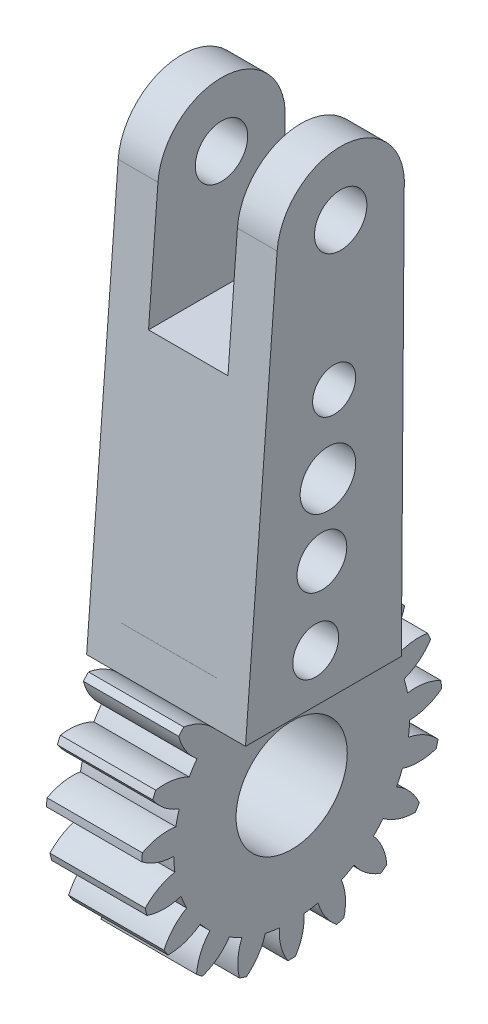
from build123d import *

# Parameters (mm, degrees)
SPUR_START             = -32.726855157
SPUR_GEAR_GB_OUTLINE_R = 22.5
SPUR_GEAR_GB_DEPTH     = 75
SKETCH_2_R             = 56.152658256
CUT_EXTRUDE_1_DEPTH    = 45
EXTRUDE_1_DEPTH        = 30
EXTRUDE_START          = -30
SKETCH_5_R             = 22.5
EXTRUDE_2_DEPTH        = 30
SCALE_1_SCALE          = 0.2
CUT_EXTRUDE_3_DEPTH    = 10
EXTRUDE_3_DEPTH        = 5
SKETCH_8_R             = 1.65
CUT_EXTRUDE_4_DEPTH    = 10
SKETCH_9_W             = 18.454746183
SKETCH_9_H             = 13.449677925
CUT_EXTRUDE_5_DEPTH    = 2.5
SKETCH_10_R            = 1.446114005
SKETCH_10_R_2          = 1.567494057
SKETCH_10_R_3          = 1.749983797
SKETCH_10_R_4          = 1.35600832
CUT_EXTRUDE_6_DEPTH    = 80.014451116


# Read off the part's stored shape, not the designer's step: spur gear_gb
with BuildPart() as part:
    # spur gear_gb outline → spur gear_gb (new body)
    with BuildSketch(Plane.YZ.offset(SPUR_START)):
        with BuildLine():
            ThreePointArc((32.862431273, 33.858374177), (32.001554259, 34.671025411), (31.120587981, 35.461853886))
            ThreePointArc((31.120587981, 35.461853886), (26.170323532, 33.302671085), (22.140322459, 29.707357493))
            ThreePointArc((22.140322459, 29.707357493), (20.304903422, 30.987038971), (18.395725829, 32.153824573))
            ThreePointArc((18.395725829, 32.153824573), (20.069385125, 37.288613083), (20.058208562, 42.689267077))
            ThreePointArc((20.058208562, 42.689267077), (18.980108815, 43.178360316), (17.890094133, 43.64029024))
            ThreePointArc((17.890094133, 43.64029024), (13.909134176, 39.99074968), (11.264886092, 35.281700885))
            ThreePointArc((11.264886092, 35.281700885), (9.113403224, 35.896086104), (6.928815473, 36.379743093))
            ThreePointArc((6.928815473, 36.379743093), (6.844528189, 41.779750883), (5.080367717, 46.884153523))
            ThreePointArc((5.080367717, 46.884153523), (3.901874073, 46.996687926), (2.720930993, 47.079662024))
            ThreePointArc((2.720930993, 47.079662024), (0.14067431, 42.335248053), (-0.831275476, 37.022762562))
            ThreePointArc((-0.831275476, 37.022762562), (-3.065675621, 36.90527335), (-5.28893955, 36.653389986))
            ThreePointArc((-5.28893955, 36.653389986), (-7.12203958, 41.733442422), (-10.448009799, 45.988452479))
            ThreePointArc((-10.448009799, 45.988452479), (-11.599189267, 45.712233197), (-12.74308724, 45.407259939))
            ThreePointArc((-12.74308724, 45.407259939), (-13.643029801, 40.082103428), (-12.837355447, 34.741871474))
            ThreePointArc((-12.837355447, 34.741871474), (-14.912540945, 33.90523961), (-16.933555907, 32.945111364))
            ThreePointArc((-16.933555907, 32.945111364), (-20.316823851, 37.154705941), (-24.844183336, 40.099227051))
            ThreePointArc((-24.844183336, 40.099227051), (-25.843300471, 39.464186729), (-26.826194241, 38.804314699))
            ThreePointArc((-26.826194241, 38.804314699), (-25.948299939, 33.475478984), (-23.452308764, 28.686197563))
            ThreePointArc((-23.452308764, 28.686197563), (-25.143401065, 27.221085091), (-26.74315873, 25.656756756))
            ThreePointArc((-26.74315873, 25.656756756), (-31.309965009, 28.539718582), (-36.548104111, 29.854666195))
            ThreePointArc((-36.548104111, 29.854666195), (-37.286889069, 28.929621306), (-38.002266845, 27.986357877))
            ThreePointArc((-38.002266845, 27.986357877), (-35.44166915, 23.231304993), (-31.525840525, 19.51196706))
            ThreePointArc((-31.525840525, 19.51196706), (-32.64958354, 17.577141651), (-33.654725342, 15.578132475))
            ThreePointArc((-33.654725342, 15.578132475), (-38.910185635, 16.822047902), (-44.291470704, 16.364927041))
            ThreePointArc((-44.291470704, 16.364927041), (-44.68986467, 15.250120552), (-45.060204171, 14.125682952))
            ThreePointArc((-45.060204171, 14.125682952), (-41.094383574, 10.459696662), (-36.183058293, 8.213350193))
            ThreePointArc((-36.183058293, 8.213350193), (-36.617677028, 6.018480201), (-36.919280256, 3.801413847))
            ThreePointArc((-36.919280256, 3.801413847), (-42.293883893, 3.271485337), (-47.235169193, 1.091832139))
            ThreePointArc((-47.235169193, 1.091832139), (-47.25, -0.091929368), (-47.235169193, -1.275690876))
            ThreePointArc((-47.235169193, -1.275690876), (-42.293883893, -3.455344074), (-36.919280256, -3.985272584))
            ThreePointArc((-36.919280256, -3.985272584), (-36.617677028, -6.202338938), (-36.183058293, -8.39720893))
            ThreePointArc((-36.183058293, -8.39720893), (-41.094383574, -10.643555399), (-45.060204171, -14.309541689))
            ThreePointArc((-45.060204171, -14.309541689), (-44.68986467, -15.433979288), (-44.291470704, -16.548785777))
            ThreePointArc((-44.291470704, -16.548785777), (-38.910185635, -17.005906639), (-33.654725342, -15.761991212))
            ThreePointArc((-33.654725342, -15.761991212), (-32.64958354, -17.761000388), (-31.525840525, -19.695825796))
            ThreePointArc((-31.525840525, -19.695825796), (-35.44166915, -23.41516373), (-38.002266845, -28.170216613))
            ThreePointArc((-38.002266845, -28.170216613), (-37.286889069, -29.113480043), (-36.548104111, -30.038524932))
            ThreePointArc((-36.548104111, -30.038524932), (-31.309965009, -28.723577319), (-26.74315873, -25.840615493))
            ThreePointArc((-26.74315873, -25.840615493), (-25.143401065, -27.404943828), (-23.452308764, -28.870056299))
            ThreePointArc((-23.452308764, -28.870056299), (-25.948299939, -33.65933772), (-26.826194241, -38.988173435))
            ThreePointArc((-26.826194241, -38.988173435), (-25.843300471, -39.648045466), (-24.844183336, -40.283085788))
            ThreePointArc((-24.844183336, -40.283085788), (-20.316823851, -37.338564677), (-16.933555907, -33.128970101))
            ThreePointArc((-16.933555907, -33.128970101), (-14.912540945, -34.089098347), (-12.837355447, -34.925730211))
            ThreePointArc((-12.837355447, -34.925730211), (-13.643029801, -40.265962164), (-12.74308724, -45.591118675))
            ThreePointArc((-12.74308724, -45.591118675), (-11.599189267, -45.896091934), (-10.448009799, -46.172311216))
            ThreePointArc((-10.448009799, -46.172311216), (-7.12203958, -41.917301159), (-5.28893955, -36.837248723))
            ThreePointArc((-5.28893955, -36.837248723), (-3.065675621, -37.089132087), (-0.831275476, -37.206621299))
            ThreePointArc((-0.831275476, -37.206621299), (0.14067431, -42.51910679), (2.720930993, -47.263520761))
            ThreePointArc((2.720930993, -47.263520761), (3.901874073, -47.180546663), (5.080367717, -47.06801226))
            ThreePointArc((5.080367717, -47.06801226), (6.844528189, -41.96360962), (6.928815473, -36.56360183))
            ThreePointArc((6.928815473, -36.56360183), (9.113403224, -36.079944841), (11.264886092, -35.465559622))
            ThreePointArc((11.264886092, -35.465559622), (13.909134176, -40.174608417), (17.890094133, -43.824148977))
            ThreePointArc((17.890094133, -43.824148977), (18.980108815, -43.362219053), (20.058208562, -42.873125814))
            ThreePointArc((20.058208562, -42.873125814), (20.069385125, -37.47247182), (18.395725829, -32.33768331))
            ThreePointArc((18.395725829, -32.33768331), (20.304903422, -31.170897707), (22.140322459, -29.891216229))
            ThreePointArc((22.140322459, -29.891216229), (26.170323532, -33.486529822), (31.120587981, -35.645712623))
            ThreePointArc((31.120587981, -35.645712623), (32.001554259, -34.854884148), (32.862431273, -34.042232914))
            ThreePointArc((32.862431273, -34.042232914), (31.119412774, -28.930572226), (27.869173851, -24.617437006))
            ThreePointArc((27.869173851, -24.617437006), (29.296052271, -22.893962115), (30.616511345, -21.087657722))
            ThreePointArc((30.616511345, -21.087657722), (35.595552259, -23.179628097), (40.978683235, -23.614472179))
            ThreePointArc((40.978683235, -23.614472179), (41.555134745, -22.58044369), (42.105499643, -21.532297832))
            ThreePointArc((42.105499643, -21.532297832), (38.797169181, -17.2635582), (34.322564452, -14.239471396))
            ThreePointArc((34.322564452, -14.239471396), (35.112519281, -12.146072463), (35.774926162, -10.008886264))
            ThreePointArc((35.774926162, -10.008886264), (41.163450577, -10.370815972), (46.396102311, -9.034199232))
            ThreePointArc((46.396102311, -9.034199232), (46.605571586, -7.869023759), (46.785783792, -6.698966145))
            ThreePointArc((46.785783792, -6.698966145), (42.270650308, -3.735731746), (37.056572625, -2.328400087))
            ThreePointArc((37.056572625, -2.328400087), (37.124, -0.091929368), (37.056572625, 2.14454135))
            ThreePointArc((37.056572625, 2.14454135), (42.270650308, 3.551873009), (46.785783792, 6.515107408))
            ThreePointArc((46.785783792, 6.515107408), (46.605571586, 7.685165023), (46.396102311, 8.850340496))
            ThreePointArc((46.396102311, 8.850340496), (41.163450577, 10.186957235), (35.774926162, 9.825027527))
            ThreePointArc((35.774926162, 9.825027527), (35.112519281, 11.962213726), (34.322564452, 14.05561266))
            ThreePointArc((34.322564452, 14.05561266), (38.797169181, 17.079699464), (42.105499643, 21.348439095))
            ThreePointArc((42.105499643, 21.348439095), (41.555134745, 22.396584953), (40.978683235, 23.430613443))
            ThreePointArc((40.978683235, 23.430613443), (35.595552259, 22.99576936), (30.616511345, 20.903798985))
            ThreePointArc((30.616511345, 20.903798985), (29.296052271, 22.710103378), (27.869173851, 24.433578269))
            ThreePointArc((27.869173851, 24.433578269), (31.119412774, 28.746713489), (32.862431273, 33.858374177))
        make_face()
        with Locations((0, -0.091929368)):
            Circle(SPUR_GEAR_GB_OUTLINE_R, mode=Mode.SUBTRACT)
    extrude(amount=SPUR_GEAR_GB_DEPTH)

    # 草图2 → 切除-拉伸1 (cut)
    with BuildSketch(Plane.ZY.offset(32.726855157)):
        with Locations((-0.091929368, 0)):
            Circle(SKETCH_2_R)
    extrude(amount=-CUT_EXTRUDE_1_DEPTH, mode=Mode.SUBTRACT)

    # 草图4 → 凸台-拉伸1 (add)
    with BuildSketch(Plane(origin=(42.273144843, 0, 0), x_dir=(0, 0, -1), z_dir=(1, 0, 0))):
        with BuildLine():
            Line((-24.433578269, 27.869173851), (-23.430613443, 40.978683235))
            Line((-23.430613443, 40.978683235), (-14.487711984, 157.869173851))
            ThreePointArc((-14.487711984, 157.869173851), (7.042421291, 176.339040577), (25.512288016, 154.808907302))
            Line((25.512288016, 154.808907302), (24.617437006, 27.869173851))
            Line((24.617437006, 27.869173851), (-24.433578269, 27.869173851))
        make_face()
    extrude(amount=-EXTRUDE_1_DEPTH)

    # 草图5 → 凸台-拉伸2 (add)
    with BuildSketch(Plane(origin=(42.273144843, 0, 0), x_dir=(0, 0, -1), z_dir=(1, 0, 0)).offset(EXTRUDE_START)):
        with Locations((0.091929368, 0)):
            Circle(SKETCH_5_R)
    extrude(amount=EXTRUDE_2_DEPTH)


with BuildPart() as part_1:
    # 缩放比例1: scaled about (27.273144843, 52.936955481, -1.705643422)
    add(part.part.scale(SCALE_1_SCALE).moved(Location((21.818515874, 42.349564385, -1.364514738))))

    # 草图6 → 切除-拉伸3 (cut)
    with BuildSketch(Plane(origin=(30.273144843, 0, 0), x_dir=(0, 0, -1), z_dir=(1, 0, 0))):
        with BuildLine():
            ThreePointArc((1.382900611, 38.849564385), (4.342900611, 44.217290275), (-1.776224322, 43.856192956))
            ThreePointArc((-1.776224322, 43.856192956), (-1.577099389, 40.481838495), (1.382900611, 38.849564385))
        make_face()
    extrude(amount=-CUT_EXTRUDE_3_DEPTH, mode=Mode.SUBTRACT)

    # 草图7 → 凸台-拉伸3 (add, symmetric)
    with BuildSketch(Plane(origin=(27.273144843, 0, 0), x_dir=(0, 0, -1), z_dir=(1, 0, 0))):
        with BuildLine():
            Line((6.288002139, 47.923399155), (6.466972341, 73.311345845))
            ThreePointArc((6.466972341, 73.311345845), (2.772998996, 77.6173725), (-1.533027659, 73.923399155))
            Line((-1.533027659, 73.923399155), (-3.321607951, 50.545301032))
            Line((-3.321607951, 50.545301032), (-3.322451181, 50.53427937))
            Line((-3.322451181, 50.53427937), (-3.522200916, 47.923399155))
            Line((-3.522200916, 47.923399155), (6.288002139, 47.923399155))
        make_face()
    extrude(amount=EXTRUDE_3_DEPTH, both=True)

    # 草图8 → 切除-拉伸4 (cut)
    with BuildSketch(Plane(origin=(32.273144843, 0, 0), x_dir=(0, 0, -1), z_dir=(1, 0, 0))):
        with Locations((2.466972341, 73.6173725)):
            Circle(SKETCH_8_R)
    extrude(amount=-CUT_EXTRUDE_4_DEPTH, mode=Mode.SUBTRACT)

    # 草图9 → 切除-拉伸5 (cut, symmetric)
    with BuildSketch(Plane(origin=(27.273144843, 0, 0), x_dir=(0, 0, -1), z_dir=(1, 0, 0))):
        with Locations((1.880211444, 72.900415106)):
            Rectangle(SKETCH_9_W, SKETCH_9_H)
    extrude(amount=CUT_EXTRUDE_5_DEPTH, both=True, mode=Mode.SUBTRACT)

    # 草图10 → 切除-拉伸6 (cut, through all)
    with BuildSketch(Plane(origin=(32.273144843, 0, 0), x_dir=(0, 0, -1), z_dir=(1, 0, 0))):
        with Locations((0.89588905, 50.944816989)):
            Circle(SKETCH_10_R)
        with Locations((1.285013172, 55.613074907)):
            Circle(SKETCH_10_R_2)
        with Locations((1.667330314, 59.914483987)):
            Circle(SKETCH_10_R_3)
        with Locations((2.056454436, 64.582741905)):
            Circle(SKETCH_10_R_4)
    extrude(amount=-CUT_EXTRUDE_6_DEPTH, mode=Mode.SUBTRACT)


solid = part_1.part
